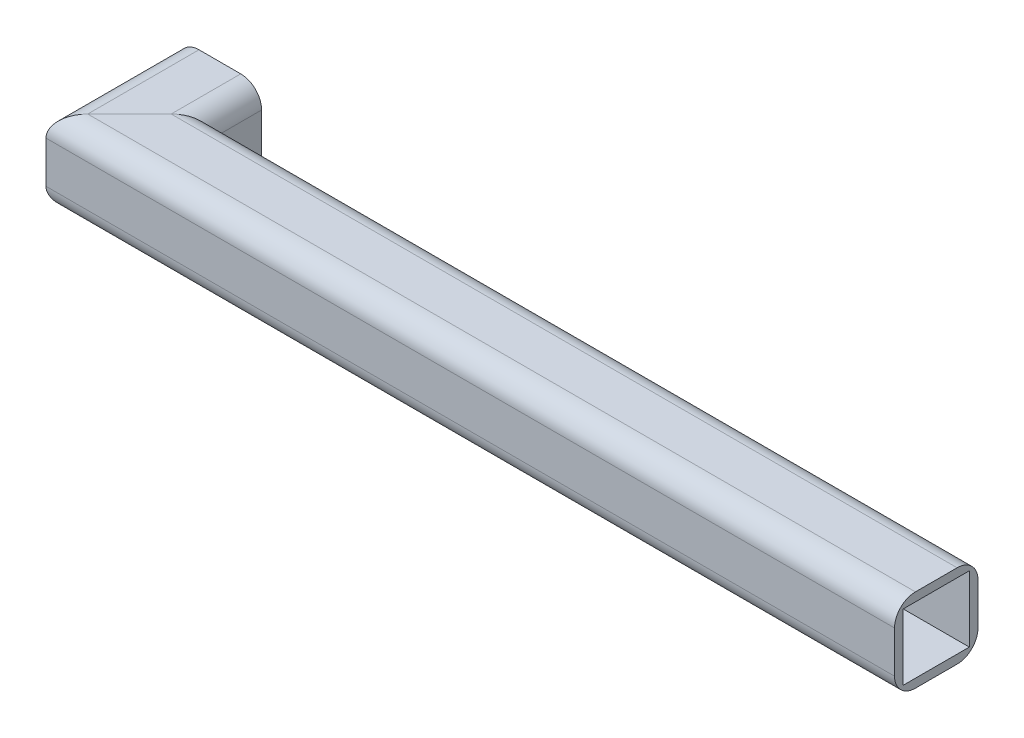
from build123d import *

# Parameters (mm, degrees)
SKETCH12_W = 120.65
SKETCH12_H = 120.65


with BuildPart() as part:
    # Sweep1: sweep along a curve in space
    with BuildLine() as sweep1_path:
        Line((60.325, 60.325, 0), (60.325, 60.325, 165.1))
        Line((60.325, 60.325, 165.1), (1533.525, 60.325, 165.1))
    # Sketch12 → Sweep1 (sweep)
    with BuildSketch(Plane.XY):
        with BuildLine():
            Line((22.225, 136.525), (98.425, 136.525))
            ThreePointArc((98.425, 136.525), (125.365768363, 125.365768363), (136.525, 98.425))
            Line((136.525, 98.425), (136.525, 22.225))
            ThreePointArc((136.525, 22.225), (125.365768363, -4.715768363), (98.425, -15.875))
            Line((98.425, -15.875), (22.225, -15.875))
            ThreePointArc((22.225, -15.875), (-4.715768363, -4.715768363), (-15.875, 22.225))
            Line((-15.875, 22.225), (-15.875, 98.425))
            ThreePointArc((-15.875, 98.425), (-4.715768363, 125.365768363), (22.225, 136.525))
        make_face()
        with Locations((60.325, 60.325)):
            Rectangle(SKETCH12_W, SKETCH12_H, mode=Mode.SUBTRACT)
    sweep(path=sweep1_path.line, transition=Transition.RIGHT)


solid = part.part
